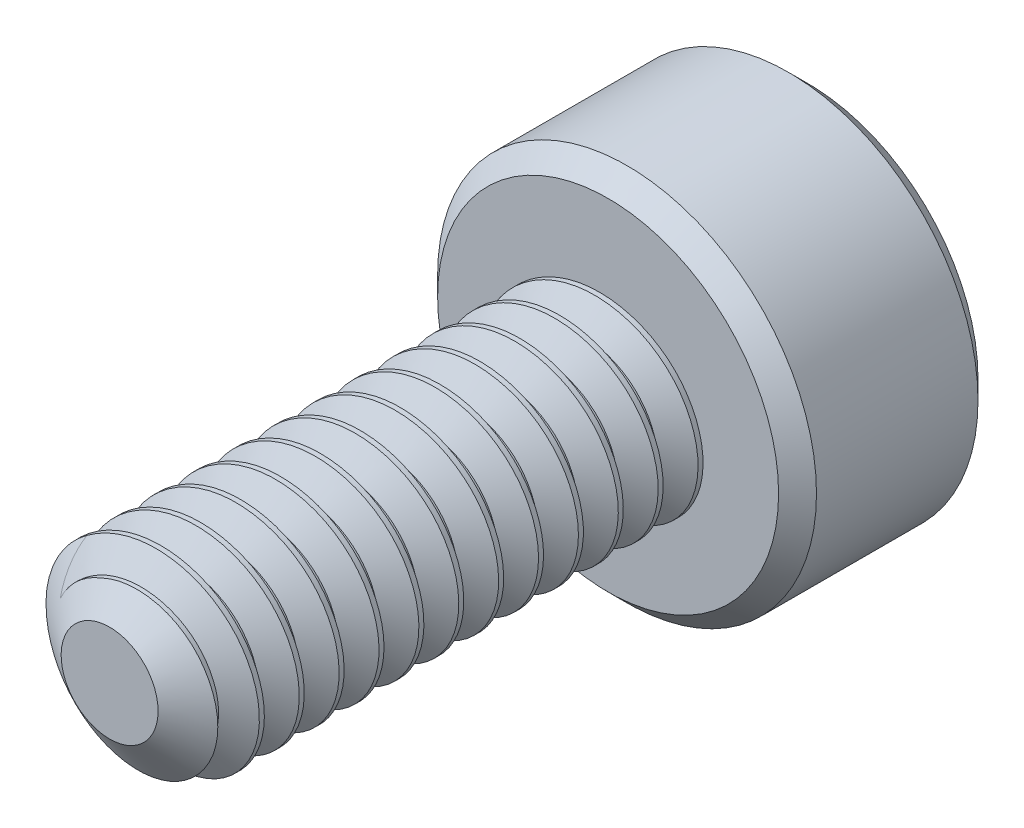
from build123d import *

# Parameters (mm, degrees)
SKETCH1_R          = 1
EXTRUDE1_DEPTH     = 5
CUT_SWEEP1_PITCH   = 0.4
SKETCH6_R          = 1.9
EXTRUDE2_DEPTH     = 2
CUT_EXTRUDE1_DEPTH = 1.125
CHAMFER1_SIZE      = 0.19


with BuildPart() as part:
    # Sketch1 → Extrude1 (new body)
    with BuildSketch(Plane.XY):
        Circle(SKETCH1_R)
    extrude(amount=-EXTRUDE1_DEPTH)

    # Cut-Sweep1: the profile of Sketch3 profile screwed along a right-hand helix of 13.5 turns, 6 arcs to a turn; built about Z, then put on its axis
    cut_sweep1_z = Axis((0, 0, 0), (0, 0, 1))
    cut_sweep1_corners = [(1.0003, 0, -0.350173205), (0.740192379, 0, -0.2), (0.740192379, 0, -0.15), (1.0003, 0, 0.000173205)]
    with BuildLine(mode=Mode.PRIVATE) as cut_sweep1_profile:
        Line(cut_sweep1_corners[0], cut_sweep1_corners[1])
        Line(cut_sweep1_corners[1], cut_sweep1_corners[2])
        Line(cut_sweep1_corners[2], cut_sweep1_corners[3])
        Line(cut_sweep1_corners[3], cut_sweep1_corners[0])
    cut_sweep1_cap = Face(cut_sweep1_profile.wire())
    cut_sweep1_turn_angles = [0, 30, 60, 90, 120, 150, 180, 210, 240, 270, 300, 330, 360]
    cut_sweep1_turn_weights = [1, 0.8660254037844387, 1, 0.8660254037844387, 1, 0.8660254037844387, 1, 0.8660254037844387, 1, 0.8660254037844387, 1, 0.8660254037844387, 1]
    cut_sweep1_turn_rails = [Edge.make_bspline([Vector(p[0], p[1], 0).rotate(cut_sweep1_z, cut_sweep1_turn_angles[k]) / cut_sweep1_turn_weights[k] + Vector(0, 0, p[2] + CUT_SWEEP1_PITCH * cut_sweep1_turn_angles[k] / 360) for k in range(13)], [0, 0, 0, 1, 1, 2, 2, 3, 3, 4, 4, 5, 5, 6, 6, 6], 2, cut_sweep1_turn_weights) for p in cut_sweep1_corners]
    cut_sweep1_turn_sides = [Face.make_surface_from_curves(cut_sweep1_turn_rails[p[0]], cut_sweep1_turn_rails[p[1]]) for p in [(0, 1), (1, 2), (2, 3), (3, 0)]]
    cut_sweep1_last_angles = [4680, 4710, 4740, 4770, 4800, 4830, 4860]
    cut_sweep1_last_weights = [1, 0.8660254037844387, 1, 0.8660254037844387, 1, 0.8660254037844466, 1]
    cut_sweep1_last_rails = [Edge.make_bspline([Vector(p[0], p[1], 0).rotate(cut_sweep1_z, cut_sweep1_last_angles[k]) / cut_sweep1_last_weights[k] + Vector(0, 0, p[2] + CUT_SWEEP1_PITCH * cut_sweep1_last_angles[k] / 360) for k in range(7)], [0, 0, 0, 1, 1, 2, 2, 3, 3, 3], 2, cut_sweep1_last_weights) for p in cut_sweep1_corners]
    cut_sweep1_last_sides = [Face.make_surface_from_curves(cut_sweep1_last_rails[p[0]], cut_sweep1_last_rails[p[1]]) for p in [(0, 1), (1, 2), (2, 3), (3, 0)]]
    cut_sweep1 = Plane(origin=(0, 0, 0), x_dir=(0, 1, 0), z_dir=(0, 0, -1)) * Solid(Shell([*[p.moved(Location((0, 0, CUT_SWEEP1_PITCH * i))) for i in range(13) for p in cut_sweep1_turn_sides], *cut_sweep1_last_sides, cut_sweep1_cap, cut_sweep1_cap.rotate(cut_sweep1_z, 4860).moved(Location((0, 0, CUT_SWEEP1_PITCH * 4860 / 360)))]))
    add(cut_sweep1, mode=Mode.SUBTRACT)

    # Sketch4 → Cut-Revolve1 (revolve, cut)
    with BuildSketch(Plane(origin=(0, 0, 0), x_dir=(0, 0, -1), z_dir=(1, 0, 0)), mode=Mode.PRIVATE) as cut_revolve1_sk:
        Polygon((0.35977197, 1), (0, 0.486192379), (0, 1), align=None)
    revolve(cut_revolve1_sk.sketch.rotate(Axis((0, 0, 0), (0, 0, -1)), 278.428757723), axis=Axis((0, 0, 0), (0, 0, -1)), mode=Mode.SUBTRACT)

    # Sketch6 → Extrude2 (add)
    with BuildSketch(Plane(origin=(0, 0, -5), x_dir=(-1, 0, 0), z_dir=(0, 0, -1))):
        Circle(SKETCH6_R)
    extrude(amount=EXTRUDE2_DEPTH)

    # Sketch7 → Cut-Extrude1 (cut)
    with BuildSketch(Plane(origin=(0, 0, -7), x_dir=(-1, 0, 0), z_dir=(0, 0, -1))):
        Polygon((0, 0.866025404), (-0.75, 0.433012702), (-0.75, -0.433012702), (0, -0.866025404), (0.75, -0.433012702), (0.75, 0.433012702), align=None)
    extrude(amount=-CUT_EXTRUDE1_DEPTH, mode=Mode.SUBTRACT)

    # Cut-Extrude2 cone 1 section (through the dimple's axis) → Cut-Extrude2 (revolve, cut)
    with BuildSketch(Plane(origin=(0, 0, -7), x_dir=(0, 1, 0), z_dir=(1, 0, 0))):
        Polygon((0, 0), (0.866025404, 0), (0, 0.866025404), align=None)
    revolve(axis=Axis((0, 0, -7), (0, 0, 1)), mode=Mode.SUBTRACT)

    # Chamfer1
    chamfer1_edges = [part.edges().sort_by_distance(p)[0] for p in [
        (1.9, 0, -5),
        (1.9, 0, -7),
    ]]
    chamfer(chamfer1_edges, length=CHAMFER1_SIZE)


solid = part.part
